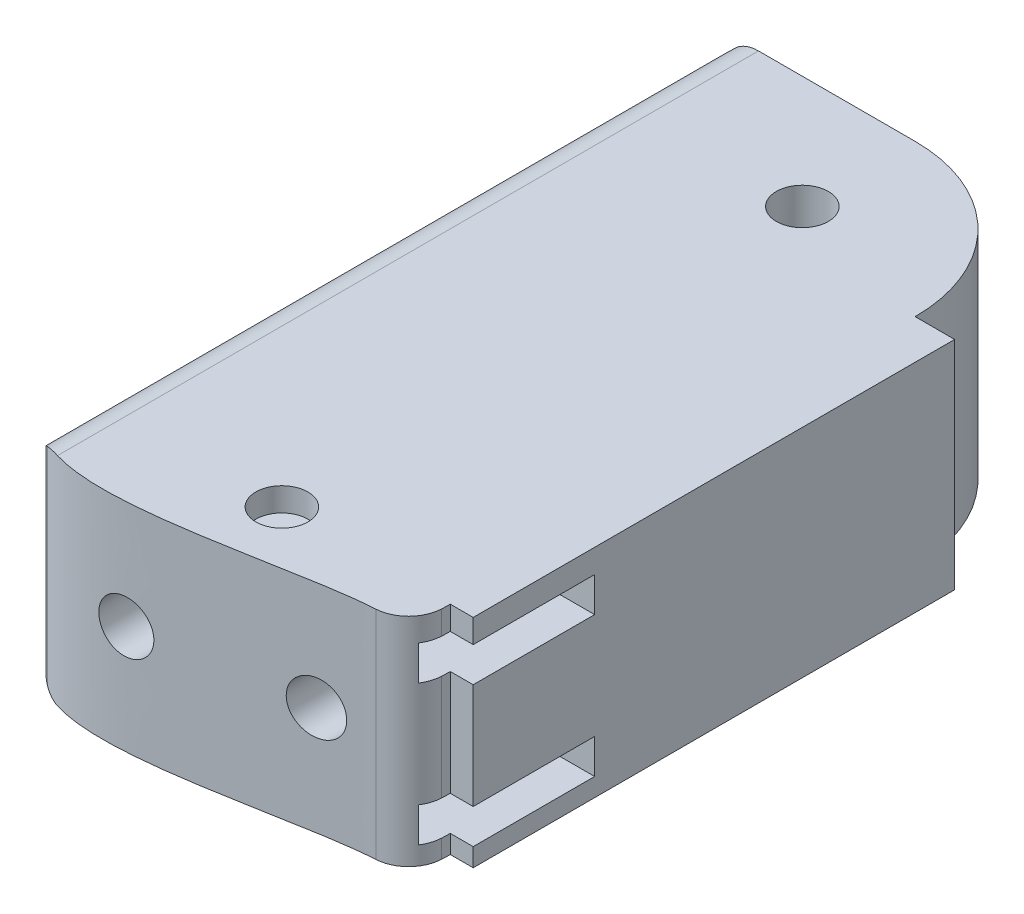
from build123d import *
from OCP.BRepAlgoAPI import BRepAlgoAPI_Cut
from OCP.TopTools import TopTools_ListOfShape

# Parameters (mm, degrees)
SKETCH1_W               = 22.054431489
SKETCH1_H               = 12.5
BOSS_EXTRUDE1_DEPTH     = 43
CUT_EXTRUDE1_DEPTH      = 10
CUT_EXTRUDE1_DEPTH_BACK = 15
SKETCH2_R               = 1.5
FILLET3_START           = -1
FILLET3_DEPTH           = 42
FILLET3_START_2         = -31
FILLET3_2_DEPTH         = 14
SKETCH5_R               = 1.5
CUT_EXTRUDE4_DEPTH      = 57.301199739
SKETCH16_W              = 22.05443149
SKETCH16_H              = 2
CUT_EXTRUDE6_DEPTH      = 8.5
FILLET4_START           = -31
FILLET4_DEPTH           = 14


with BuildPart() as part:
    # Sketch1 → Boss-Extrude1 (new body)
    with BuildSketch(Plane.XY):
        with Locations((-13.228930986, -24.070183414)):
            Rectangle(SKETCH1_W, SKETCH1_H)
    extrude(amount=BOSS_EXTRUDE1_DEPTH)

    # Sketch2 → Cut-Extrude1 (cut, two sides: drawn at the far end of the back side and taken through both)
    with BuildSketch(Plane.XZ.offset(30.320183414).offset(-CUT_EXTRUDE1_DEPTH_BACK)):
        with Locations(Location((-13.228930986, 6.5, 0), (0, 0, 90))):
            Circle(SKETCH2_R)
        with Locations(Location((-13.228930986, 36.5, 0), (0, 0, 90))):
            Circle(SKETCH2_R)
        with BuildLine():
            Line((-3.524026068, 36.5), (-2.201715242, 36.5))
            add(Edge.make_bspline(
                [(-24.256146731, 33.845079723), (-30.410867424, 43.557524996), (-12.605557553, 54.855746483), (11.277296074, 42.57460591), (-2.201715242, 36.5)],
                knots=[0, 0, 0, 0, 0.503104745, 1, 1, 1, 1], degree=3))
            add(Edge.make_bspline(
                [(-3.83164653, 38.924092472), (-9.250736817, 38.125111697), (-28.532285754, 46.163812106), (-24.256146731, 33.845079723)],
                knots=[0, 0, 0, 0, 1, 1, 1, 1], degree=3))
            ThreePointArc((-3.83164653, 38.924092472), (-3.601238334, 37.721766617), (-3.524026068, 36.5))
        make_face()
        with BuildLine():
            Line((-4.478930986, 8.75), (-2.201715242, 8.75))
            add(Edge.make_bspline(
                [(-2.201715242, 8.75), (5.39210746, 3.880294823), (-0.777052631, -4.523329032), (-17.174300591, -10.623347238), (-34.821400648, -0.026005424), (-24.256146731, 8.75)],
                knots=[0, 0, 0, 0, 0.283272691, 0.504244858, 1, 1, 1, 1], degree=3))
            add(Edge.make_bspline(
                [(-23.490579314, 0), (-24.966512963, 4.237786421), (-24.256146731, 8.75)],
                knots=[0, 0, 0, 1, 1, 1], degree=2))
            Line((-23.490579314, 0), (-13.228930986, 0))
            ThreePointArc((-13.228930986, 0), (-7.041746651, 2.562815665), (-4.478930986, 8.75))
        make_face()
    extrude(amount=CUT_EXTRUDE1_DEPTH + CUT_EXTRUDE1_DEPTH_BACK, mode=Mode.SUBTRACT)


with BuildPart() as fillet3_tool:
    # Fillet3: read off the stored shape, not the designer's step
    # Fillet3 outline → Fillet3 (new body)
    with BuildSketch(Plane.XY.offset(FILLET3_START)):
        with BuildLine():
            Line((-24.256146731, -17.820183414), (-24.256146731, -19.820183414))
            ThreePointArc((-24.256146731, -19.820183414), (-23.670360293, -18.405969851), (-22.256146731, -17.820183414))
            Line((-22.256146731, -17.820183414), (-24.256146731, -17.820183414))
        make_face()
        with BuildLine():
            ThreePointArc((-22.256146731, -30.320183414), (-23.670360293, -29.734396976), (-24.256146731, -28.320183414))
            Line((-24.256146731, -28.320183414), (-24.256146731, -30.320183414))
            Line((-24.256146731, -30.320183414), (-22.256146731, -30.320183414))
        make_face()
    extrude(amount=FILLET3_DEPTH)


with BuildPart() as part_1:
    add(part.part)

    # Fillet3: cut by fillet3_tool, with a tolerance
    fillet3_stock = TopTools_ListOfShape()
    fillet3_stock.Append(part_1.part.wrapped)
    fillet3_tools = TopTools_ListOfShape()
    fillet3_tools.Append(fillet3_tool.part.wrapped)
    fillet3_cut = BRepAlgoAPI_Cut()
    fillet3_cut.SetArguments(fillet3_stock)
    fillet3_cut.SetTools(fillet3_tools)
    fillet3_cut.SetFuzzyValue(0.00001)
    fillet3_cut.Build()
    add(Compound.cast(fillet3_cut.Shape()).solids(), mode=Mode.REPLACE)


with BuildPart() as fillet3_2_tool:
    # Fillet3 2 outline → Fillet3 2 (new body)
    with BuildSketch(Plane(origin=(0, 0, 0), x_dir=(1, 0, 0), z_dir=(0, 1, 0)).offset(FILLET3_START_2)):
        with BuildLine():
            Line((-24.256146731, -3.001504812), (-24.256146731, -3.16929397))
            ThreePointArc((-24.256146731, -3.16929397), (-24.248700679, -2.996873655), (-24.226417966, -2.82573719))
            add(Edge.make_bspline(
                [(-24.226417966, -2.82573719), (-24.241732441, -2.913564505), (-24.256146731, -3.001504812)],
                knots=[0.329874436, 0.329874436, 0.329874436, 0.350165787, 0.350165787, 0.350165787], degree=2))
        make_face()
        with BuildLine():
            ThreePointArc((-23.275055203, -39.963216674), (-23.99364737, -39.232721814), (-24.256146731, -38.242221169))
            Line((-24.256146731, -38.242221169), (-24.256146731, -39.081457115))
            add(Edge.make_bspline(
                [(-24.256146731, -39.081457115), (-23.999461699, -39.439477902), (-23.668462552, -39.730301433), (-23.275055203, -39.963216674)],
                knots=[0.20342968, 0.20342968, 0.20342968, 0.20342968, 0.271697972, 0.271697972, 0.271697972, 0.271697972], degree=3))
        make_face()
    extrude(amount=FILLET3_2_DEPTH)


with BuildPart() as part_2:
    add(part_1.part)

    # Fillet3 2: cut by fillet3_2_tool, with a tolerance
    fillet3_2_stock = TopTools_ListOfShape()
    fillet3_2_stock.Append(part_2.part.wrapped)
    fillet3_2_tools = TopTools_ListOfShape()
    fillet3_2_tools.Append(fillet3_2_tool.part.wrapped)
    fillet3_2_cut = BRepAlgoAPI_Cut()
    fillet3_2_cut.SetArguments(fillet3_2_stock)
    fillet3_2_cut.SetTools(fillet3_2_tools)
    fillet3_2_cut.SetFuzzyValue(0.00001)
    fillet3_2_cut.Build()
    add(Compound.cast(fillet3_2_cut.Shape()).solids(), mode=Mode.REPLACE)

    # Sketch5 → Cut-Extrude4 (cut, through all)
    with BuildSketch(Plane.XY):
        with Locations(Location((-18.011106811, -24.070183414, 0), (0, 0, 180))):
            Circle(SKETCH5_R)
        with Locations(Location((-8.446755162, -24.070183414, 0), (0, 0, 180))):
            Circle(SKETCH5_R)
    extrude(amount=CUT_EXTRUDE4_DEPTH, mode=Mode.SUBTRACT)

    # Sketch16 → Cut-Extrude6 (cut)
    with BuildSketch(Plane.XY.offset(38)):
        with Locations((-13.228930985, -20.1809771)):
            Rectangle(SKETCH16_W, SKETCH16_H)
        with Locations((-13.228930985, -28.261916897)):
            Rectangle(SKETCH16_W, SKETCH16_H)
    extrude(amount=-CUT_EXTRUDE6_DEPTH, mode=Mode.SUBTRACT)

    # Fillet4: read off the stored shape, not the designer's step
    # Fillet4 outline → Fillet4 (cut)
    with BuildSketch(Plane(origin=(0, 0, 0), x_dir=(1, 0, 0), z_dir=(0, 1, 0)).offset(FILLET4_START)):
        with BuildLine():
            ThreePointArc((-3.536641618, -36.994677952), (-4.113301238, -38.300390358), (-5.413622589, -38.88910556))
            add(Edge.make_bspline(
                [(-5.413622589, -38.88910556), (-4.807642485, -38.852553426), (-4.273553237, -38.858938555), (-3.83164653, -38.924092472)],
                knots=[0.91845371, 0.91845371, 0.91845371, 0.91845371, 1, 1, 1, 1], degree=3))
            ThreePointArc((-3.83164653, -38.924092472), (-3.635515677, -37.966820429), (-3.536641618, -36.994677952))
        make_face()
    extrude(amount=FILLET4_DEPTH, mode=Mode.SUBTRACT)


solid = part_2.part
